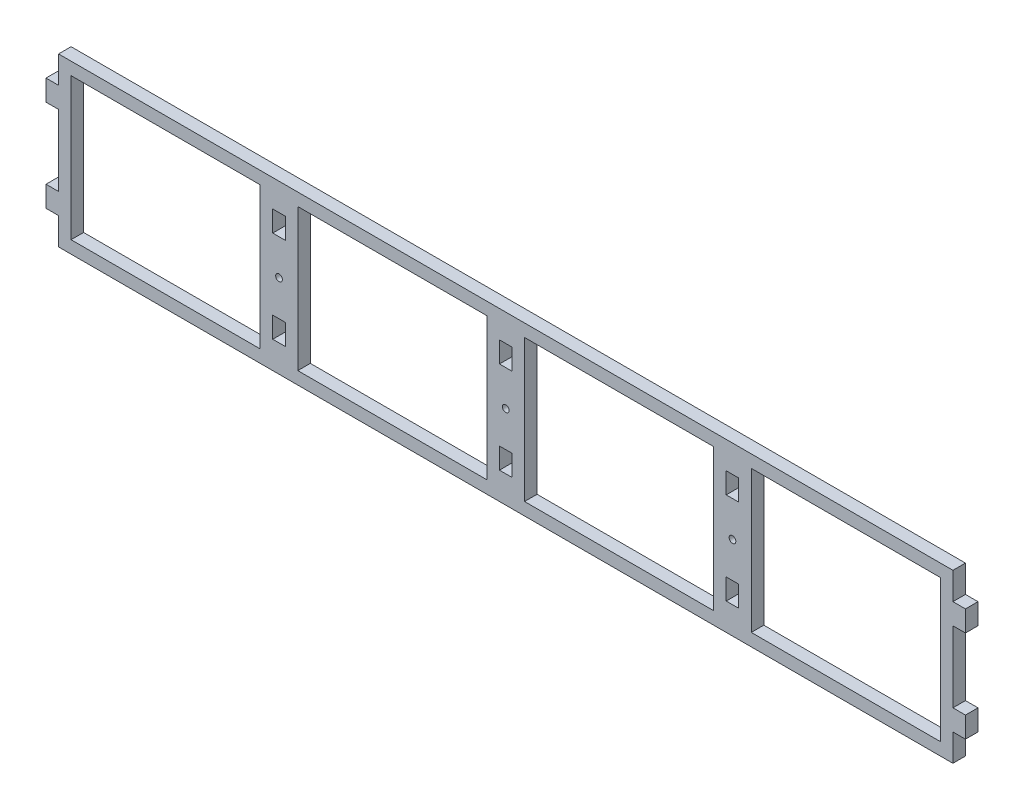
from build123d import *

# Parameters (mm, degrees)
SKETCH1_W           = 428
SKETCH1_H           = 80
BOSS_EXTRUDE1_DEPTH = 6
CUT_EXTRUDE1_REACH  = 219.789
SKETCH2_W           = 90.5
SKETCH2_H           = 68
LPATTERN1_COUNT     = 4
LPATTERN1_PITCH     = 108.5
SKETCH3_R           = 1.6
SKETCH3_W           = 6
SKETCH3_H           = 10
CUT_EXTRUDE2_DEPTH  = 218.788888605
SKETCH4_W           = 6
SKETCH4_H           = 10
BOSS_EXTRUDE2_DEPTH = 6


with BuildPart() as part:
    # Sketch1 → Boss-Extrude1 (new body)
    with BuildSketch(Plane.XY):
        Rectangle(SKETCH1_W, SKETCH1_H)
    extrude(amount=BOSS_EXTRUDE1_DEPTH)

    # Sketch2 → Cut-Extrude1 (cut, up to next)
    with BuildSketch(Plane.XY.offset(6), mode=Mode.PRIVATE) as cut_extrude1_sk1:
        with Locations((-162.75, 0)):
            Rectangle(SKETCH2_W, SKETCH2_H)
    cut_extrude1_tool1 = extrude(cut_extrude1_sk1.sketch, amount=-CUT_EXTRUDE1_REACH, mode=Mode.PRIVATE) & part.part
    cut_extrude1 = cut_extrude1_tool1.solids().sort_by_distance((-162.75, 0, 6))[0]
    add(cut_extrude1, mode=Mode.SUBTRACT)

    # LPattern1: Cut-Extrude1 ×4
    with Locations(*[(i * LPATTERN1_PITCH, 0, 0) for i in range(1, LPATTERN1_COUNT)]):
        add(cut_extrude1, mode=Mode.SUBTRACT)

    # Sketch3 → Cut-Extrude2 (cut, through all)
    with BuildSketch(Plane(origin=(0, 0, 0), x_dir=(-1, 0, 0), z_dir=(0, 0, -1))):
        with Locations((108.5, 0)):
            Circle(SKETCH3_R)
        Circle(SKETCH3_R)
        with Locations((-108.5, 0)):
            Circle(SKETCH3_R)
        with Locations((-108.5, -22)):
            Rectangle(SKETCH3_W, SKETCH3_H)
        with Locations((-108.5, 22)):
            Rectangle(SKETCH3_W, SKETCH3_H)
        with Locations((0, 22)):
            Rectangle(SKETCH3_W, SKETCH3_H)
        with Locations((0, -22)):
            Rectangle(SKETCH3_W, SKETCH3_H)
        with Locations((108.5, 22)):
            Rectangle(SKETCH3_W, SKETCH3_H)
        with Locations((108.5, -22)):
            Rectangle(SKETCH3_W, SKETCH3_H)
    extrude(amount=-CUT_EXTRUDE2_DEPTH, mode=Mode.SUBTRACT)

    # Sketch4 → Boss-Extrude2 (add)
    with BuildSketch(Plane(origin=(0, 0, 0), x_dir=(-1, 0, 0), z_dir=(0, 0, -1))):
        with Locations((-217, 22)):
            Rectangle(SKETCH4_W, SKETCH4_H)
        with Locations((-217, -22)):
            Rectangle(SKETCH4_W, SKETCH4_H)
        with Locations((217, -22)):
            Rectangle(SKETCH4_W, SKETCH4_H)
        with Locations((217, 22)):
            Rectangle(SKETCH4_W, SKETCH4_H)
    extrude(amount=-BOSS_EXTRUDE2_DEPTH)


solid = part.part
